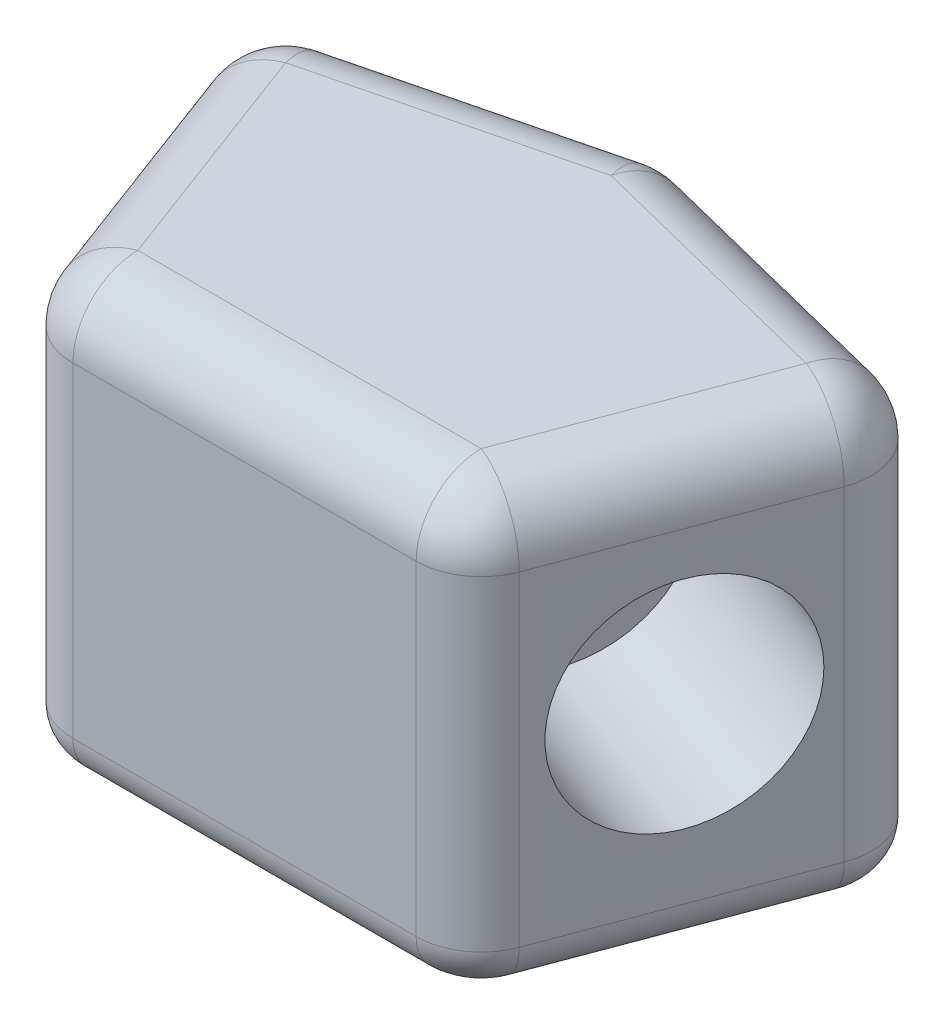
from build123d import *

# Parameters (mm, degrees)
BOSS_EXTRUDE1_DEPTH = 10
SKETCH2_R           = 2.5
CUT_EXTRUDE1_DEPTH  = 5
SKETCH3_R           = 2.5
CUT_EXTRUDE2_DEPTH  = 5
SKETCH4_R           = 1.5
CUT_EXTRUDE3_DEPTH  = 1
FILLET1_R           = 1.5
FILLET2_R           = 1.5
FILLET3_R           = 1


with BuildPart() as part:
    # Sketch1 → Boss-Extrude1 (new body)
    with BuildSketch(Plane(origin=(0, 0, 0), x_dir=(1, 0, 0), z_dir=(0, 1, 0))):
        Polygon((-5, 0), (5, 0), (8, 8), (0, 10), (-8, 8), align=None)
    extrude(amount=BOSS_EXTRUDE1_DEPTH)

    # Sketch2 → Cut-Extrude1 (cut)
    with BuildSketch(Plane(origin=(4.383561644, 0, 1.643835616), x_dir=(0.35112344158839154, 0, -0.9363291775690447), z_dir=(0.9363291775690445, 0, 0.3511234415883915))):
        with Locations((5.755617208, 5)):
            Circle(SKETCH2_R)
    extrude(amount=-CUT_EXTRUDE1_DEPTH, mode=Mode.SUBTRACT)

    # Sketch3 → Cut-Extrude2 (cut)
    with BuildSketch(Plane(origin=(-4.383561644, 0, 1.643835616), x_dir=(0.3511234415883919, 0, 0.9363291775690445), z_dir=(-0.9363291775690445, 0, 0.3511234415883919))):
        with Locations((-5.755617208, 5)):
            Circle(SKETCH3_R)
    extrude(amount=-CUT_EXTRUDE2_DEPTH, mode=Mode.SUBTRACT)

    # Sketch4 → Cut-Extrude3 (cut)
    with BuildSketch(Plane.XZ):
        with Locations(Location((0, -5, 0), (0, 0, 270))):
            Circle(SKETCH4_R)
    extrude(amount=-CUT_EXTRUDE3_DEPTH, mode=Mode.SUBTRACT)

    # Fillet1
    fillet1_edges = [part.edges().sort_by_distance(p)[0] for p in [
        (-8, 5, -8),
        (0, 5, -10),
        (8, 5, -8),
        (5, 5, 0),
        (-5, 5, 0),
    ]]
    fillet(fillet1_edges, radius=FILLET1_R)

    # Fillet2
    fillet2_edges = [part.edges().sort_by_distance(p)[0] for p in [
        (-3.366403469, 10, -9.158399133),
        (3.366403469, 10, -9.158399133),
        (-6.387343447, 10, -3.699582525),
        (0, 10, 0),
        (6.387343447, 10, -3.699582525),
        (7.333243577, 10, -7.649887814),
        (4.814891554, 10, -0.267111574),
        (-4.814891554, 10, -0.267111574),
        (-7.333243577, 10, -7.649887814),
        (0, 10, -9.95383539),
    ]]
    fillet(fillet2_edges, radius=FILLET2_R)

    # Fillet3
    fillet3_edges = [part.edges().sort_by_distance(p)[0] for p in [
        (0, 0, -3.5),
        (-3.366403469, 0, -9.158399133),
        (-6.387343447, 0, -3.699582525),
        (3.366403469, 0, -9.158399133),
        (6.387343447, 0, -3.699582525),
        (0, 0, 0),
        (7.333243577, 0, -7.649887814),
        (4.814891554, 0, -0.267111574),
        (-4.814891554, 0, -0.267111574),
        (-7.333243577, 0, -7.649887814),
        (0, 0, -9.95383539),
    ]]
    fillet(fillet3_edges, radius=FILLET3_R - 0.0001)  # a hair under: the kernel refuses the full size


solid = part.part
